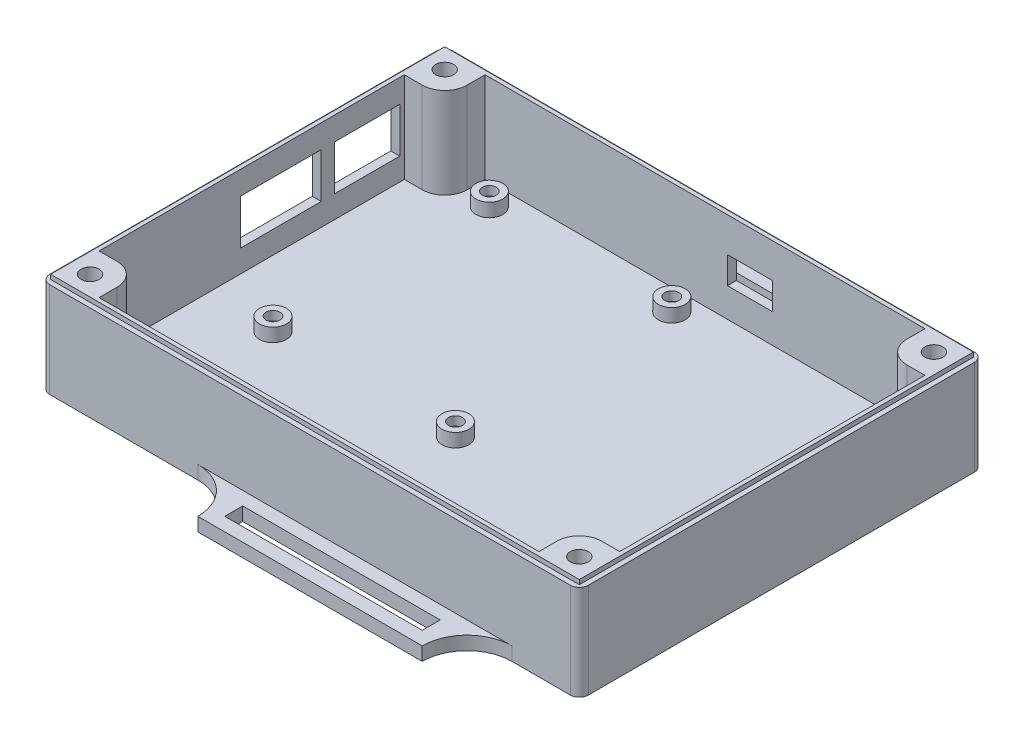
from build123d import *

# Parameters (mm, degrees)
SKETCH1_W           = 120
SKETCH1_H           = 90
BOSS_EXTRUDE1_DEPTH = 22.2
SHELL1_T            = -2
SKETCH2_W           = 9
SKETCH2_H           = 9
BOSS_EXTRUDE2_DEPTH = 20.2
SKETCH5_W           = 120
SKETCH5_H           = 90
SKETCH5_W_2         = 117.8
SKETCH5_H_2         = 87.8
CUT_EXTRUDE2_DEPTH  = 1
SKETCH6_R           = 2
CUT_EXTRUDE3_DEPTH  = 25
SKETCH13_R          = 3
CUT_EXTRUDE8_DEPTH  = 15
SKETCH14_W          = 50
SKETCH14_H          = 3
BOSS_EXTRUDE4_DEPTH = 10
SKETCH15_W          = 44
SKETCH15_H          = 4
CUT_EXTRUDE9_DEPTH  = 10
SKETCH16_W          = 50
SKETCH16_H          = 3
BOSS_EXTRUDE5_DEPTH = 10
SKETCH17_W          = 44
SKETCH17_H          = 4
CUT_EXTRUDE10_DEPTH = 10
SKETCH22_W          = 14.5
SKETCH22_H          = 10
SKETCH22_W_2        = 18
CUT_EXTRUDE15_DEPTH = 10
SKETCH23_W          = 10
SKETCH23_H          = 6
CUT_EXTRUDE16_DEPTH = 10
FILLET1_R           = 10
FILLET4_R           = 5
FILLET9_R           = 2
SKETCH26_R          = 3
BOSS_EXTRUDE7_DEPTH = 3
SKETCH27_R          = 1.55
CUT_EXTRUDE17_DEPTH = 2


with BuildPart() as part:
    # Sketch1 → Boss-Extrude1 (new body)
    with BuildSketch(Plane(origin=(0, 0, 0), x_dir=(1, 0, 0), z_dir=(0, 1, 0))):
        with Locations((60, 45)):
            Rectangle(SKETCH1_W, SKETCH1_H)
    extrude(amount=BOSS_EXTRUDE1_DEPTH)

    # Shell1
    shell1_openings = [part.faces().sort_by_distance(p)[0] for p in [
        (60, 22.2, -45),
    ]]
    offset(amount=SHELL1_T, openings=shell1_openings, kind=Kind.INTERSECTION)

    # Sketch2 → Boss-Extrude2 (add)
    with BuildSketch(Plane(origin=(0, 2, 0), x_dir=(1, 0, 0), z_dir=(0, 1, 0))):
        with Locations((6.5, 6.5)):
            Rectangle(SKETCH2_W, SKETCH2_H)
        with Locations((113.5, 83.5)):
            Rectangle(SKETCH2_W, SKETCH2_H)
        with Locations((113.5, 6.5)):
            Rectangle(SKETCH2_W, SKETCH2_H)
        with Locations((6.5, 83.5)):
            Rectangle(SKETCH2_W, SKETCH2_H)
    extrude(amount=BOSS_EXTRUDE2_DEPTH)

    # Sketch5 → Cut-Extrude2 (cut)
    with BuildSketch(Plane(origin=(0, 22.2, 0), x_dir=(1, 0, 0), z_dir=(0, 1, 0))):
        with Locations((60, 45)):
            Rectangle(SKETCH5_W, SKETCH5_H)
        with Locations((60, 45)):
            Rectangle(SKETCH5_W_2, SKETCH5_H_2, mode=Mode.SUBTRACT)
    extrude(amount=-CUT_EXTRUDE2_DEPTH, mode=Mode.SUBTRACT)

    # Sketch6 → Cut-Extrude3 (cut)
    with BuildSketch(Plane(origin=(0, 22.2, 0), x_dir=(1, 0, 0), z_dir=(0, 1, 0))):
        with Locations(Location((114.5, 84.5, 0), (0, 0, 270))):
            Circle(SKETCH6_R)
        with Locations(Location((114.5, 5.5, 0), (0, 0, 270))):
            Circle(SKETCH6_R)
        with Locations(Location((5.5, 84.5, 0), (0, 0, 270))):
            Circle(SKETCH6_R)
        with Locations(Location((5.5, 5.5, 0), (0, 0, 270))):
            Circle(SKETCH6_R)
    extrude(amount=-CUT_EXTRUDE3_DEPTH, mode=Mode.SUBTRACT)

    # Sketch13 → Cut-Extrude8 (cut)
    with BuildSketch(Plane.XZ):
        with Locations(Location((114.5, -5.5, 0), (0, 0, 270))):
            Circle(SKETCH13_R)
        with Locations(Location((114.5, -84.5, 0), (0, 0, 270))):
            Circle(SKETCH13_R)
        with Locations(Location((5.5, -5.5, 0), (0, 0, 270))):
            Circle(SKETCH13_R)
        with Locations(Location((5.5, -84.5, 0), (0, 0, 270))):
            Circle(SKETCH13_R)
    extrude(amount=-CUT_EXTRUDE8_DEPTH, mode=Mode.SUBTRACT)

    # Sketch14 → Boss-Extrude4 (add)
    with BuildSketch(Plane.XY):
        with Locations((70, 1.5)):
            Rectangle(SKETCH14_W, SKETCH14_H)
    extrude(amount=BOSS_EXTRUDE4_DEPTH)

    # Sketch15 → Cut-Extrude9 (cut)
    with BuildSketch(Plane(origin=(0, 0, 0), x_dir=(-1, 0, 0), z_dir=(0, -1, 0))):
        with Locations((-70, -5)):
            Rectangle(SKETCH15_W, SKETCH15_H)
    extrude(amount=-CUT_EXTRUDE9_DEPTH, mode=Mode.SUBTRACT)

    # Sketch16 → Boss-Extrude5 (add)
    with BuildSketch(Plane(origin=(0, 0, -90), x_dir=(-1, 0, 0), z_dir=(0, 0, -1))):
        with Locations((-70, 1.5)):
            Rectangle(SKETCH16_W, SKETCH16_H)
    extrude(amount=BOSS_EXTRUDE5_DEPTH)

    # Sketch17 → Cut-Extrude10 (cut)
    with BuildSketch(Plane(origin=(0, 0, 0), x_dir=(-1, 0, 0), z_dir=(0, -1, 0))):
        with Locations((-70, 95)):
            Rectangle(SKETCH17_W, SKETCH17_H)
    extrude(amount=-CUT_EXTRUDE10_DEPTH, mode=Mode.SUBTRACT)

    # Sketch22 → Cut-Extrude15 (cut)
    with BuildSketch(Plane.ZY):
        with Locations((-70.75, 12)):
            Rectangle(SKETCH22_W, SKETCH22_H)
        with Locations((-51.5, 12)):
            Rectangle(SKETCH22_W_2, SKETCH22_H)
    extrude(amount=-CUT_EXTRUDE15_DEPTH, mode=Mode.SUBTRACT)

    # Sketch23 → Cut-Extrude16 (cut)
    with BuildSketch(Plane(origin=(0, 0, -90), x_dir=(-1, 0, 0), z_dir=(0, 0, -1))):
        with Locations((-70, 11.5)):
            Rectangle(SKETCH23_W, SKETCH23_H)
    extrude(amount=-CUT_EXTRUDE16_DEPTH, mode=Mode.SUBTRACT)

    # Fillet1
    fillet1_edges = [part.edges().sort_by_distance(p)[0] for p in [
        (95, 1.5, -90),
        (95, 1.5, 0),
        (45, 1.5, 0),
        (45, 1.5, -90),
    ]]
    fillet(fillet1_edges, radius=FILLET1_R - 0.0001)  # a hair under: the kernel refuses the full size

    # Fillet4
    fillet4_edges = [part.edges().sort_by_distance(p)[0] for p in [
        (11, 12.1, -11),
        (109, 12.1, -79),
        (11, 12.1, -79),
        (109, 12.1, -11),
    ]]
    fillet(fillet4_edges, radius=FILLET4_R)

    # Fillet9
    fillet9_edges = [part.edges().sort_by_distance(p)[0] for p in [
        (0, 10.6, -90),
        (120, 10.6, -90),
        (120, 10.6, 0),
        (0, 10.6, 0),
    ]]
    fillet(fillet9_edges, radius=FILLET9_R)

    # Sketch26 → Boss-Extrude7 (add)
    with BuildSketch(Plane(origin=(0, 2, 0), x_dir=(1, 0, 0), z_dir=(0, 1, 0))):
        with Locations(Location((16.75, 83.2, 0), (0, 0, 90))):
            Circle(SKETCH26_R)
        with Locations(Location((16.75, 35, 0), (0, 0, 90))):
            Circle(SKETCH26_R)
        with Locations(Location((57.4, 35, 0), (0, 0, 90))):
            Circle(SKETCH26_R)
        with Locations(Location((57.4, 83.2, 0), (0, 0, 90))):
            Circle(SKETCH26_R)
    extrude(amount=BOSS_EXTRUDE7_DEPTH)

    # Sketch27 → Cut-Extrude17 (cut)
    with BuildSketch(Plane(origin=(0, 5, 0), x_dir=(1, 0, 0), z_dir=(0, 1, 0))):
        with Locations(Location((57.4, 83.2, 0), (0, 0, 270))):
            Circle(SKETCH27_R)
        with Locations(Location((57.4, 35, 0), (0, 0, 270))):
            Circle(SKETCH27_R)
        with Locations(Location((16.75, 35, 0), (0, 0, 270))):
            Circle(SKETCH27_R)
        with Locations(Location((16.75, 83.2, 0), (0, 0, 270))):
            Circle(SKETCH27_R)
    extrude(amount=-CUT_EXTRUDE17_DEPTH, mode=Mode.SUBTRACT)


solid = part.part
